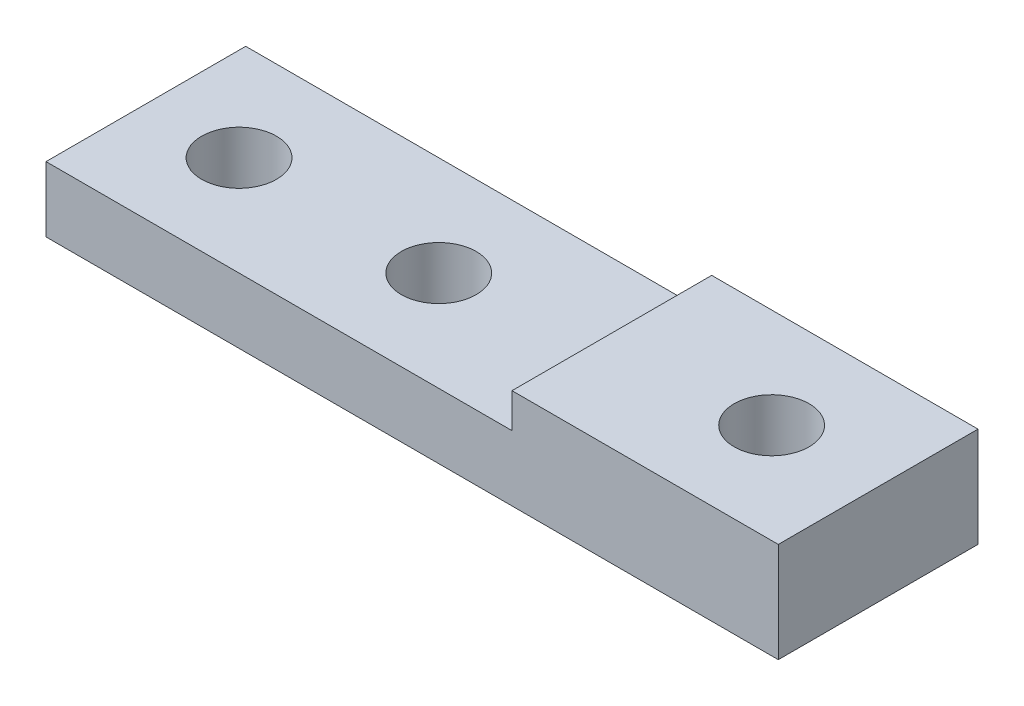
from build123d import *

# Parameters (mm, degrees)
SKETCH1_W               = 69.85
SKETCH1_H               = 19.05
BOSS_EXTRUDE1_DEPTH     = 6.223
SKETCH4_W               = 25.4
SKETCH4_H               = 19.05
BOSS_EXTRUDE2_DEPTH     = 3.302
F_1_4_CLEARANCE_HOLE2_D = 7.14248


with BuildPart() as part:
    # Sketch1 → Boss-Extrude1 (new body)
    with BuildSketch(Plane(origin=(0, 0, 0), x_dir=(1, 0, 0), z_dir=(0, 1, 0))):
        Rectangle(SKETCH1_W, SKETCH1_H)
    extrude(amount=BOSS_EXTRUDE1_DEPTH)

    # Sketch4 → Boss-Extrude2 (add)
    with BuildSketch(Plane(origin=(0, 6.223, 0), x_dir=(1, 0, 0), z_dir=(0, 1, 0))):
        with Locations((22.225, 0)):
            Rectangle(SKETCH4_W, SKETCH4_H)
    extrude(amount=BOSS_EXTRUDE2_DEPTH)

    # 1/4 Clearance Hole2 (through all)
    with Locations(Plane(origin=(0, 0, 0), x_dir=(-1, 0, 0), z_dir=(0, -1, 0))):
        with Locations((-24.765, 0), (6.985, 0), (26.035, 0)):
            Hole(F_1_4_CLEARANCE_HOLE2_D / 2)


solid = part.part
